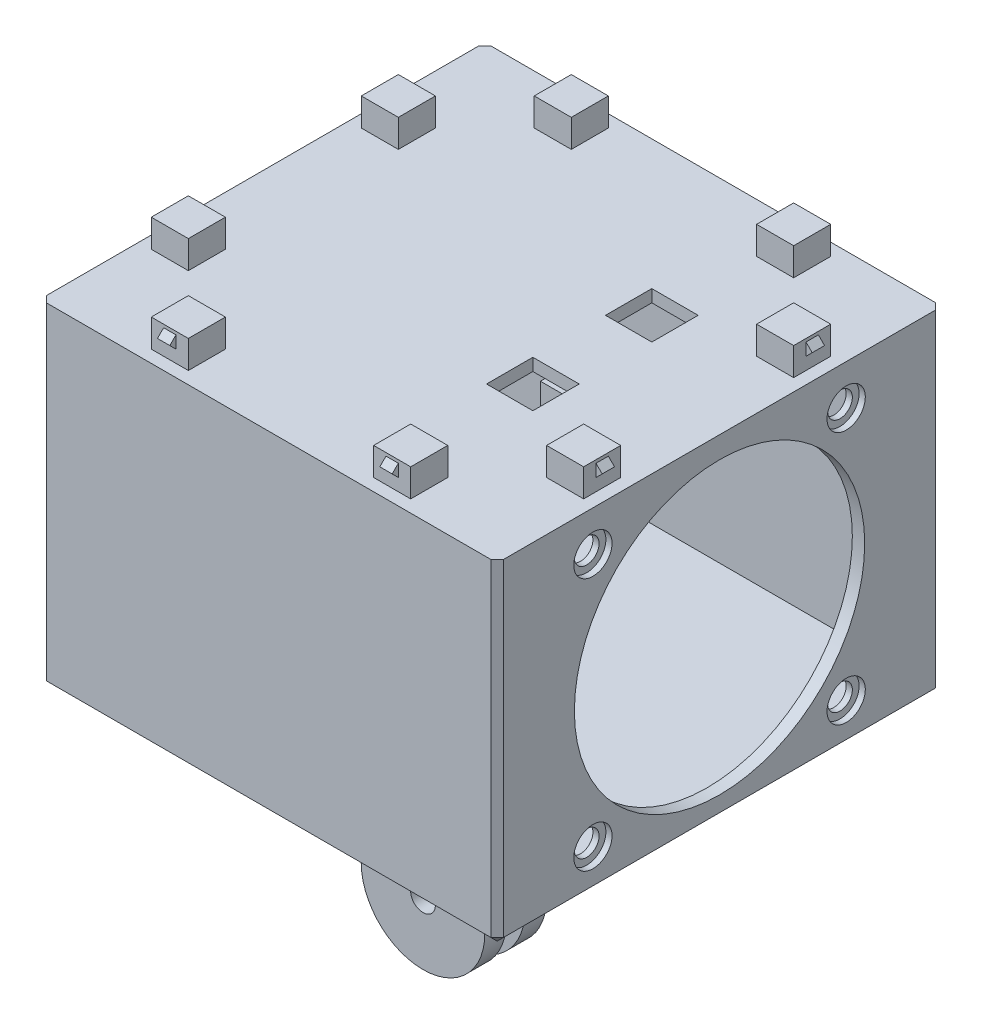
from build123d import *

# Parameters (mm, degrees)
SKETCH_1_W          = 74
SKETCH_1_H          = 72
EXTRUDE_1_DEPTH     = 54
SKETCH_2_W          = 70
SKETCH_2_H          = 68
CUT_EXTRUDE_1_DEPTH = 52
SKETCH_4_R          = 23.5
SKETCH_4_R_2        = 2
CUT_EXTRUDE_2_DEPTH = 2
SKETCH_5_W          = 14
SKETCH_5_H          = 68
CUT_EXTRUDE_3_DEPTH = 2
SKETCH_6_W          = 9
SKETCH_6_H          = 2
EXTRUDE_2_DEPTH     = 5
SKETCH_7_W          = 9
SKETCH_7_H          = 2
EXTRUDE_3_DEPTH     = 5
CUT_EXTRUDE_4_REACH = 101.89
SKETCH_9_W          = 64
SKETCH_9_H          = 46
SKETCH_10_W         = 4
SKETCH_10_H         = 8
EXTRUDE_5_DEPTH     = 5
SKETCH_11_W         = 4
SKETCH_11_H         = 8
EXTRUDE_6_DEPTH     = 5
SKETCH_15_W         = 70
SKETCH_15_H         = 68
EXTRUDE_7_DEPTH     = 2
SKETCH_16_W         = 6
SKETCH_16_H         = 6
EXTRUDE_8_DEPTH     = 4.5
SKETCH_17_W         = 2
SKETCH_17_H         = 2
EXTRUDE_9_DEPTH     = 1
SKETCH_18_W         = 2
SKETCH_18_H         = 2
EXTRUDE_10_DEPTH    = 1
SKETCH_19_W         = 2
SKETCH_19_H         = 2
EXTRUDE_11_DEPTH    = 1
SKETCH_20_W         = 2
SKETCH_20_H         = 2
EXTRUDE_12_DEPTH    = 1
CUT_EXTRUDE_5_REACH = 94.782
SKETCH_21_W         = 7.5
SKETCH_21_H         = 7.5
SKETCH_25_W         = 20
SKETCH_25_H         = 10
EXTRUDE_15_DEPTH    = 30
SKETCH_26_R         = 10
EXTRUDE_16_DEPTH    = 10
SKETCH_27_R         = 2
CUT_EXTRUDE_6_DEPTH = 10
CUT_EXTRUDE_7_REACH = 90.422
SKETCH_29_W         = 3
SKETCH_29_H         = 27
CUT_EXTRUDE_8_REACH = 106.96
SKETCH_30_W         = 3
SKETCH_30_H         = 3
CHAMFER_1_SIZE      = 1
CHAMFER_2_SIZE      = 1
SKETCH_31_R         = 3.1
CUT_EXTRUDE_9_DEPTH = 1
CHAMFER_3_SIZE      = 1


with BuildPart() as part:
    # 草图1 → 凸台-拉伸1 (new body)
    with BuildSketch(Plane(origin=(0, 0, 0), x_dir=(1, 0, 0), z_dir=(0, 1, 0))):
        with Locations((-28.715316709, -3.823796856)):
            Rectangle(SKETCH_1_W, SKETCH_1_H)
    extrude(amount=EXTRUDE_1_DEPTH)

    # 草图2 → 切除-拉伸1 (cut)
    with BuildSketch(Plane(origin=(0, 54, 0), x_dir=(1, 0, 0), z_dir=(0, 1, 0))):
        with Locations((-28.715316709, -3.823796856)):
            Rectangle(SKETCH_2_W, SKETCH_2_H)
    extrude(amount=-CUT_EXTRUDE_1_DEPTH, mode=Mode.SUBTRACT)

    # 草图4 → 切除-拉伸2 (cut)
    with BuildSketch(Plane(origin=(8.284683291, 0, 0), x_dir=(0, 0, -1), z_dir=(1, 0, 0))):
        with Locations((-3.823796856, 27)):
            Circle(SKETCH_4_R)
        with Locations((16.676203144, 6.5)):
            Circle(SKETCH_4_R_2)
        with Locations((-24.323796856, 47.5)):
            Circle(SKETCH_4_R_2)
        with Locations((-24.323796856, 6.5)):
            Circle(SKETCH_4_R_2)
        with Locations((16.676203144, 47.5)):
            Circle(SKETCH_4_R_2)
    extrude(amount=-CUT_EXTRUDE_2_DEPTH, mode=Mode.SUBTRACT)

    # 草图5 → 切除-拉伸3 (cut)
    with BuildSketch(Plane.XZ):
        with Locations((-56.715316709, 3.823796856)):
            Rectangle(SKETCH_5_W, SKETCH_5_H)
    extrude(amount=-CUT_EXTRUDE_3_DEPTH, mode=Mode.SUBTRACT)

    # 草图6 → 凸台-拉伸2 (add)
    with BuildSketch(Plane(origin=(0, 0, 37.823796856), x_dir=(-1, 0, 0), z_dir=(0, 0, -1))):
        with Locations((59.215316709, 53)):
            Rectangle(SKETCH_6_W, SKETCH_6_H)
    extrude(amount=EXTRUDE_2_DEPTH)

    # 草图7 → 凸台-拉伸3 (add)
    with BuildSketch(Plane.XY.offset(-30.176203144)):
        with Locations((-59.215316709, 53)):
            Rectangle(SKETCH_7_W, SKETCH_7_H)
    extrude(amount=EXTRUDE_3_DEPTH)

    # 草图9 → 切除-拉伸4 (cut, up to next)
    with BuildSketch(Plane.ZY.offset(65.715316709), mode=Mode.PRIVATE) as cut_extrude_4_sk1:
        with Locations((3.823796856, 27)):
            Rectangle(SKETCH_9_W, SKETCH_9_H)
    cut_extrude_4_tool1 = extrude(cut_extrude_4_sk1.sketch, amount=-CUT_EXTRUDE_4_REACH, mode=Mode.PRIVATE) & part.part
    add(cut_extrude_4_tool1.solids().sort_by_distance((-65.715317, 27, 3.823797))[0], mode=Mode.SUBTRACT)

    # 草图10 → 凸台-拉伸5 (add)
    with BuildSketch(Plane(origin=(0, 0, 37.823796856), x_dir=(-1, 0, 0), z_dir=(0, 0, -1))):
        with Locations((47.715316709, 14)):
            Rectangle(SKETCH_10_W, SKETCH_10_H)
        with Locations((47.715316709, 29)):
            Rectangle(SKETCH_10_W, SKETCH_10_H)
        with Locations((47.715316709, 44)):
            Rectangle(SKETCH_10_W, SKETCH_10_H)
    extrude(amount=EXTRUDE_5_DEPTH)

    # 草图11 → 凸台-拉伸6 (add)
    with BuildSketch(Plane.XY.offset(-30.176203144)):
        with Locations((-47.715316709, 14)):
            Rectangle(SKETCH_11_W, SKETCH_11_H)
        with Locations((-47.715316709, 29)):
            Rectangle(SKETCH_11_W, SKETCH_11_H)
        with Locations((-47.715316709, 44)):
            Rectangle(SKETCH_11_W, SKETCH_11_H)
    extrude(amount=EXTRUDE_6_DEPTH)

    # 草图15 → 凸台-拉伸7 (add)
    with BuildSketch(Plane(origin=(0, 54, 0), x_dir=(1, 0, 0), z_dir=(0, 1, 0))):
        with Locations((-28.715316709, -3.823796856)):
            Rectangle(SKETCH_15_W, SKETCH_15_H)
    extrude(amount=-EXTRUDE_7_DEPTH)

    # 草图16 → 凸台-拉伸8 (add)
    with BuildSketch(Plane(origin=(0, 54, 0), x_dir=(1, 0, 0), z_dir=(0, 1, 0))):
        with Locations((-46.715316709, -34.823796856)):
            Rectangle(SKETCH_16_W, SKETCH_16_H)
        with Locations((-60.715316709, 13.176203144)):
            Rectangle(SKETCH_16_W, SKETCH_16_H)
        with Locations((-10.715316709, -34.823796856)):
            Rectangle(SKETCH_16_W, SKETCH_16_H)
        with Locations((-46.715316709, 27.176203144)):
            Rectangle(SKETCH_16_W, SKETCH_16_H)
        with Locations((-10.715316709, 27.176203144)):
            Rectangle(SKETCH_16_W, SKETCH_16_H)
        with Locations((3.284683291, 13.176203144)):
            Rectangle(SKETCH_16_W, SKETCH_16_H)
        with Locations((3.284683291, -20.823796856)):
            Rectangle(SKETCH_16_W, SKETCH_16_H)
        with Locations((-60.715316709, -20.823796856)):
            Rectangle(SKETCH_16_W, SKETCH_16_H)
    extrude(amount=EXTRUDE_8_DEPTH)

    # 草图17 → 凸台-拉伸9 (add)
    with BuildSketch(Plane.ZY.offset(63.715316709)):
        with Locations((-13.176203144, 57)):
            Rectangle(SKETCH_17_W, SKETCH_17_H)
        with Locations((20.823796856, 57)):
            Rectangle(SKETCH_17_W, SKETCH_17_H)
    extrude(amount=EXTRUDE_9_DEPTH)

    # 草图18 → 凸台-拉伸10 (add)
    with BuildSketch(Plane.XY.offset(37.823796856)):
        with Locations((-10.715316709, 57)):
            Rectangle(SKETCH_18_W, SKETCH_18_H)
        with Locations((-46.715316709, 57)):
            Rectangle(SKETCH_18_W, SKETCH_18_H)
    extrude(amount=EXTRUDE_10_DEPTH)

    # 草图19 → 凸台-拉伸11 (add)
    with BuildSketch(Plane(origin=(6.284683291, 0, 0), x_dir=(0, 0, -1), z_dir=(1, 0, 0))):
        with Locations((13.176203144, 57)):
            Rectangle(SKETCH_19_W, SKETCH_19_H)
        with Locations((-20.823796856, 57)):
            Rectangle(SKETCH_19_W, SKETCH_19_H)
    extrude(amount=EXTRUDE_11_DEPTH)

    # 草图20 → 凸台-拉伸12 (add)
    with BuildSketch(Plane(origin=(0, 0, -30.176203144), x_dir=(-1, 0, 0), z_dir=(0, 0, -1))):
        with Locations((46.715316709, 57)):
            Rectangle(SKETCH_20_W, SKETCH_20_H)
        with Locations((10.715316709, 57)):
            Rectangle(SKETCH_20_W, SKETCH_20_H)
    extrude(amount=EXTRUDE_12_DEPTH)

    # 草图21 → 切除-拉伸5 (cut, up to next)
    with BuildSketch(Plane(origin=(0, 52, 0), x_dir=(-1, 0, 0), z_dir=(0, -1, 0)), mode=Mode.PRIVATE) as cut_extrude_5_sk1:
        with Locations((13.936875607, -11.824892758)):
            Rectangle(SKETCH_21_W, SKETCH_21_H)
    cut_extrude_5_tool1 = extrude(cut_extrude_5_sk1.sketch, amount=-CUT_EXTRUDE_5_REACH, mode=Mode.PRIVATE) & part.part
    # 草图21 → 切除-拉伸5 (cut, up to next)
    with BuildSketch(Plane(origin=(0, 52, 0), x_dir=(-1, 0, 0), z_dir=(0, -1, 0)), mode=Mode.PRIVATE) as cut_extrude_5_sk2:
        with Locations((13.936875607, 7.433232356)):
            Rectangle(SKETCH_21_W, SKETCH_21_H)
    cut_extrude_5_tool2 = extrude(cut_extrude_5_sk2.sketch, amount=-CUT_EXTRUDE_5_REACH, mode=Mode.PRIVATE) & part.part
    add(cut_extrude_5_tool1.solids().sort_by_distance((-13.936876, 52, 11.824893))[0], mode=Mode.SUBTRACT)
    add(cut_extrude_5_tool2.solids().sort_by_distance((-13.936876, 52, -7.433232))[0], mode=Mode.SUBTRACT)

    # 草图25 → 凸台-拉伸15 (add)
    with BuildSketch(Plane.XZ):
        with Locations((-34.727823945, 3.823796856)):
            Rectangle(SKETCH_25_W, SKETCH_25_H)
    extrude(amount=EXTRUDE_15_DEPTH)

    # 草图26 → 凸台-拉伸16 (add)
    with BuildSketch(Plane.XY.offset(8.823796856)):
        with Locations((-34.727823945, -30)):
            Circle(SKETCH_26_R)
    extrude(amount=-EXTRUDE_16_DEPTH)

    # 草图27 → 切除-拉伸6 (cut)
    with BuildSketch(Plane.XY.offset(8.823796856)):
        with Locations((-34.727823945, -30)):
            Circle(SKETCH_27_R)
    extrude(amount=-CUT_EXTRUDE_6_DEPTH, mode=Mode.SUBTRACT)

    # 草图29 → 切除-拉伸7 (cut, up to next)
    with BuildSketch(Plane.ZY.offset(44.727823945), mode=Mode.PRIVATE) as cut_extrude_7_sk1:
        with Locations((3.823796856, -26.5)):
            Rectangle(SKETCH_29_W, SKETCH_29_H)
    cut_extrude_7_tool1 = extrude(cut_extrude_7_sk1.sketch, amount=-CUT_EXTRUDE_7_REACH, mode=Mode.PRIVATE) & part.part
    add(cut_extrude_7_tool1.solids().sort_by_distance((-44.727824, -26.5, 3.823797))[0], mode=Mode.SUBTRACT)

    # 草图30 → 切除-拉伸8 (cut, up to next)
    with BuildSketch(Plane.XZ.offset(13), mode=Mode.PRIVATE) as cut_extrude_8_sk1:
        with Locations((-34.727823945, 3.823796856)):
            Rectangle(SKETCH_30_W, SKETCH_30_H)
    cut_extrude_8_tool1 = extrude(cut_extrude_8_sk1.sketch, amount=-CUT_EXTRUDE_8_REACH, mode=Mode.PRIVATE) & part.part
    add(cut_extrude_8_tool1.solids().sort_by_distance((-34.727824, -13, 3.823797))[0], mode=Mode.SUBTRACT)

    # 倒角1
    chamfer_1_edges = [part.edges().sort_by_distance(p)[0] for p in [
        (-28.715316709, 0, -32.176203144),
        (8.284683291, 0, 3.823796856),
        (-28.715316709, 0, 39.823796856),
        (-65.715316709, 0, 3.823796856),
        (-65.715316709, 27, -32.176203144),
        (8.284683291, 27, -32.176203144),
        (8.284683291, 27, 39.823796856),
        (-65.715316709, 27, 39.823796856),
    ]]
    chamfer(chamfer_1_edges, length=CHAMFER_1_SIZE)

    # 倒角2
    chamfer_2_edges = [part.edges().sort_by_distance(p)[0] for p in [
        (7.284683291, 58, 20.823796856),
        (7.284683291, 58, -13.176203144),
        (-10.715316709, 58, -31.176203144),
        (-46.715316709, 58, -31.176203144),
        (-64.715316709, 58, -13.176203144),
        (-64.715316709, 58, 20.823796856),
        (-10.715316709, 58, 38.823796856),
        (-46.715316709, 58, 38.823796856),
    ]]
    chamfer(chamfer_2_edges, length=CHAMFER_2_SIZE - 0.0001)  # a hair under: the kernel refuses the full size

    # 草图31 → 切除-拉伸9 (cut)
    with BuildSketch(Plane(origin=(8.284683291, 0, 0), x_dir=(0, 0, -1), z_dir=(1, 0, 0))):
        with Locations((16.676203144, 6.5)):
            Circle(SKETCH_31_R)
        with Locations((-24.323796856, 6.5)):
            Circle(SKETCH_31_R)
        with Locations((-24.323796856, 47.5)):
            Circle(SKETCH_31_R)
        with Locations((16.676203144, 47.5)):
            Circle(SKETCH_31_R)
    extrude(amount=-CUT_EXTRUDE_9_DEPTH, mode=Mode.SUBTRACT)

    # 倒角3
    chamfer_3_edges = [part.edges().sort_by_distance(p)[0] for p in [
        (-64.715316709, 56, 20.823796856),
        (-64.715316709, 56, -13.176203144),
        (-46.715316709, 56, -31.176203144),
        (-10.715316709, 56, -31.176203144),
        (7.284683291, 56, -13.176203144),
        (7.284683291, 56, 20.823796856),
        (-46.715316709, 56, 38.823796856),
        (-10.715316709, 56, 38.823796856),
    ]]
    chamfer(chamfer_3_edges, length=CHAMFER_3_SIZE - 0.0001)  # a hair under: the kernel refuses the full size


solid = part.part
